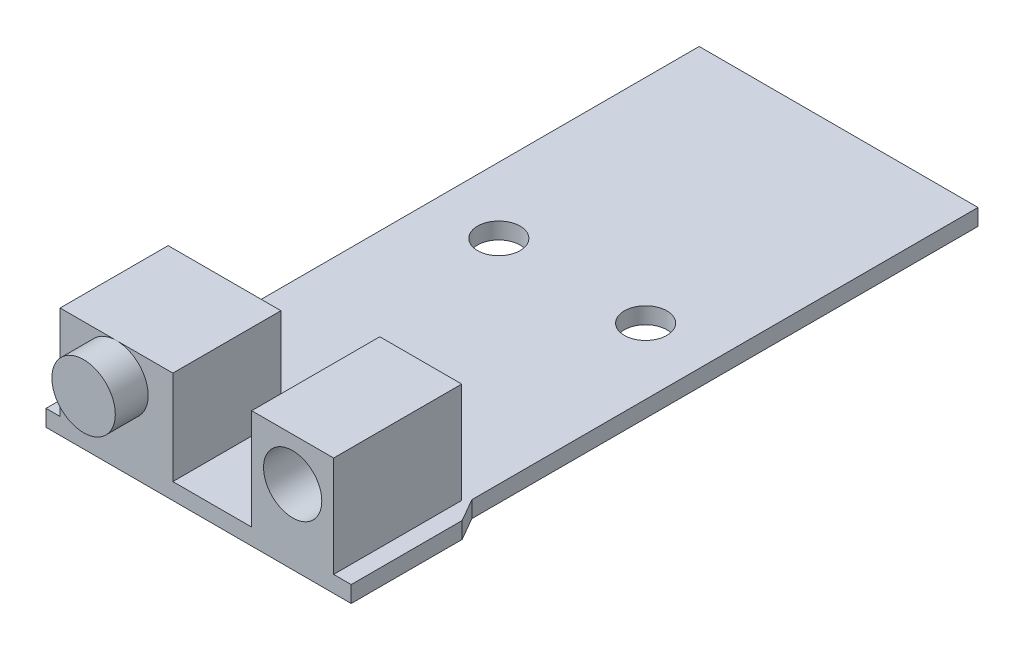
from build123d import *

# Parameters (mm, degrees)
BOSS_EXTRUDE1_DEPTH = 1.778
SKETCH2_W           = 8.86
SKETCH2_H           = 13.85
BOSS_EXTRUDE2_DEPTH = 10.9
SKETCH3_R           = 2.3
CUT_EXTRUDE1_DEPTH  = 72.970132694
SKETCH4_W           = 12.192
SKETCH4_H           = 11.684
BOSS_EXTRUDE3_DEPTH = 10.16
SKETCH5_R           = 3.429
BOSS_EXTRUDE4_DEPTH = 3.556
SKETCH6_R           = 3.1496
CUT_EXTRUDE2_DEPTH  = 11.656


with BuildPart() as part:
    # Sketch1 → Boss-Extrude1 (new body)
    with BuildSketch(Plane(origin=(0, 0, 0), x_dir=(1, 0, 0), z_dir=(0, 1, 0))):
        Polygon((-15.075, 69.2), (15.075, 69.2), (15.075, 14.468172401), (16.5, 12), (16.5, 0), (-16.5, 0), (-16.5, 12), (-15.075, 14.468172401), align=None)
    extrude(amount=BOSS_EXTRUDE1_DEPTH)

    # Sketch2 → Boss-Extrude2 (add)
    with BuildSketch(Plane(origin=(0, 1.778, 0), x_dir=(1, 0, 0), z_dir=(0, 1, 0))):
        with Locations((10.17, 6.925)):
            Rectangle(SKETCH2_W, SKETCH2_H)
    extrude(amount=BOSS_EXTRUDE2_DEPTH)

    # Sketch3 → Cut-Extrude1 (cut, through all)
    with BuildSketch(Plane(origin=(0, 1.778, 0), x_dir=(1, 0, 0), z_dir=(0, 1, 0))):
        with Locations((-7.9375, 40.4)):
            Circle(SKETCH3_R)
        with Locations((7.9375, 40.4)):
            Circle(SKETCH3_R)
    extrude(amount=-CUT_EXTRUDE1_DEPTH, mode=Mode.SUBTRACT)

    # Sketch4 → Boss-Extrude3 (add)
    with BuildSketch(Plane(origin=(0, 1.778, 0), x_dir=(1, 0, 0), z_dir=(0, 1, 0))):
        with Locations((-8.88, 5.842)):
            Rectangle(SKETCH4_W, SKETCH4_H)
    extrude(amount=BOSS_EXTRUDE3_DEPTH)

    # Sketch5 → Boss-Extrude4 (add)
    with BuildSketch(Plane.XY):
        with Locations((-8.88, 8.509)):
            Circle(SKETCH5_R)
    extrude(amount=BOSS_EXTRUDE4_DEPTH)

    # Sketch6 → Cut-Extrude2 (cut)
    with BuildSketch(Plane.XY):
        with Locations((10.17, 8.0044)):
            Circle(SKETCH6_R)
    extrude(amount=-CUT_EXTRUDE2_DEPTH, mode=Mode.SUBTRACT)


solid = part.part
